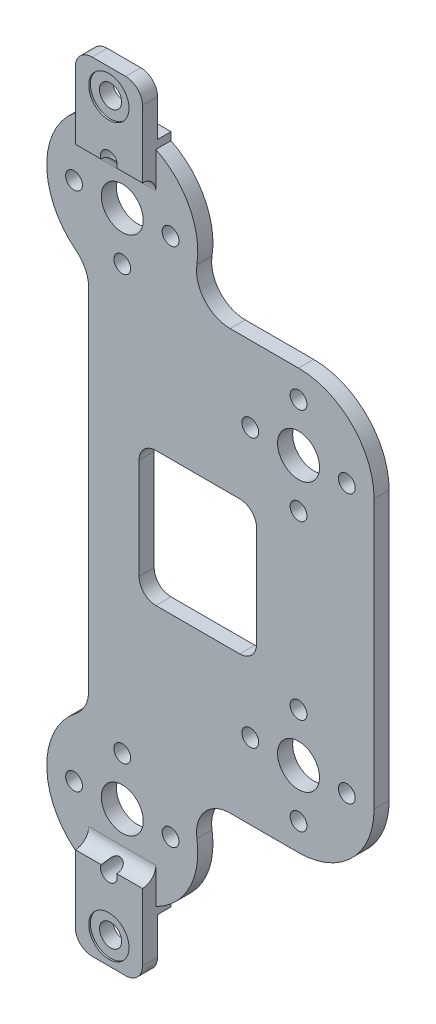
from build123d import *
from OCP.BRepFilletAPI import BRepFilletAPI_MakeFillet

# Parameters (mm, degrees)
SKETCH_1_W                   = 20
SKETCH_1_H                   = 232
EXTRUDE_1_DEPTH              = 4.5
FILLET_4_R                   = 5
EXTRUDE_START                = 4
EXTRUDE_4_DEPTH              = 4
SKETCH_9_W                   = 319.021375536
SKETCH_9_H                   = 251.112704656
SKETCH_9_W_2                 = 165.944204682
SKETCH_9_H_2                 = 200
CUT_EXTRUDE_1_DEPTH          = 4
FILLET_5_R                   = 4
HOLE_WIZARD_M6_2_D           = 6.6
HOLE_WIZARD_M6_2_CBORE_D     = 12
HOLE_WIZARD_M6_2_CBORE_DEPTH = 0.5
SKETCH_12_W                  = 65
SKETCH_12_H                  = 125
SKETCH_12_R                  = 6.25
EXTRUDE_5_DEPTH              = 4.5
SKETCH_14_R                  = 22.5
EXTRUDE_6_DEPTH              = 4.5
FILLET_6_R1                  = 10
FILLET_6_R2                  = 22.5
SKETCH_13_R                  = 6.25
CUT_EXTRUDE_2_DEPTH          = 139.39526726
HOLE_WIZARD_M6_1_D           = 5
SKETCH_17_W                  = 35
SKETCH_17_H                  = 40
CUT_EXTRUDE_3_DEPTH          = 139.395267266
FILLET_8_R                   = 5


with BuildPart() as part:
    # 草图1 → 凸台-拉伸1 (new body)
    with BuildSketch(Plane.XY):
        Rectangle(SKETCH_1_W, SKETCH_1_H)
    extrude(amount=EXTRUDE_1_DEPTH)

    # 圆角4
    fillet_4_edges = [part.edges().sort_by_distance(p)[0] for p in [
        (10, -116, 2.25),
        (-10, -116, 2.25),
        (-10, 116, 2.25),
        (10, 116, 2.25),
    ]]
    fillet(fillet_4_edges, radius=FILLET_4_R)

    # 草图8 → 凸台-拉伸4 (add)
    with BuildSketch(Plane.XY.offset(4.5).offset(EXTRUDE_START)):
        with BuildLine():
            Line((10, -91), (-10, -91))
            Line((-10, -91), (-10, -111))
            ThreePointArc((-10, -111), (-8.535533906, -114.535533906), (-5, -116))
            Line((-5, -116), (5, -116))
            ThreePointArc((5, -116), (8.535533906, -114.535533906), (10, -111))
            Line((10, -111), (10, -91))
        make_face()
        with BuildLine():
            Line((-10, 111), (-10, 91))
            Line((-10, 91), (10, 91))
            Line((10, 91), (10, 111))
            ThreePointArc((10, 111), (8.535533906, 114.535533906), (5, 116))
            Line((5, 116), (-5, 116))
            ThreePointArc((-5, 116), (-8.535533906, 114.535533906), (-10, 111))
        make_face()
    extrude(amount=-EXTRUDE_4_DEPTH)

    # 草图9 → 切除-拉伸1 (cut)
    with BuildSketch(Plane(origin=(0, 0, 0), x_dir=(-1, 0, 0), z_dir=(0, 0, -1))):
        Rectangle(SKETCH_9_W, SKETCH_9_H)
        Rectangle(SKETCH_9_W_2, SKETCH_9_H_2, mode=Mode.SUBTRACT)
    extrude(amount=-CUT_EXTRUDE_1_DEPTH, mode=Mode.SUBTRACT)

    # 圆角5
    fillet_5_edges = [part.edges().sort_by_distance(p)[0] for p in [
        (0, -91, 4.5),
        (0, 91, 4.5),
    ]]
    fillet(fillet_5_edges, radius=FILLET_5_R - 0.0001)  # a hair under: the kernel refuses the full size

    # M6 六角头螺栓的柱形沉头孔2 (through all)
    with Locations(Plane.XY.offset(8.5)):
        with Locations((0, 108.25), (0, -108.25)):
            CounterBoreHole(HOLE_WIZARD_M6_2_D / 2, HOLE_WIZARD_M6_2_CBORE_D / 2, HOLE_WIZARD_M6_2_CBORE_DEPTH)

    # 草图12 → 凸台-拉伸5 (add)
    with BuildSketch(Plane(origin=(0, 0, 0), x_dir=(-1, 0, 0), z_dir=(0, 0, -1))):
        with Locations((-42.5, 0)):
            Rectangle(SKETCH_12_W, SKETCH_12_H)
        with Locations((-52.5, 40)):
            Circle(SKETCH_12_R, mode=Mode.SUBTRACT)
        with Locations((-52.5, -40)):
            Circle(SKETCH_12_R, mode=Mode.SUBTRACT)
    extrude(amount=-EXTRUDE_5_DEPTH)

    # 草图14 → 凸台-拉伸6 (add)
    with BuildSketch(Plane(origin=(0, 0, 0), x_dir=(-1, 0, 0), z_dir=(0, 0, -1))):
        with Locations((0, 77.5)):
            Circle(SKETCH_14_R)
        with Locations((0, -77.5)):
            Circle(SKETCH_14_R)
    extrude(amount=-EXTRUDE_6_DEPTH)

    # 圆角6: one fillet with a radius per group of edges: ONE call of the kernel's fillet builder (fillet() takes one radius for all edges)
    fillet_6_edges_1 = [part.edges().sort_by_distance(p)[0] for p in [
        (16.770509831, 62.5, 2.25),
        (-10, 57.344355629, 2.25),
        (16.770509831, -62.5, 2.25),
        (-10, -57.344355629, 2.25),
    ]]
    fillet_6_edges_2 = [part.edges().sort_by_distance(p)[0] for p in [
        (75, 62.5, 2.25),
        (75, -62.5, 2.25),
    ]]
    fillet_6 = BRepFilletAPI_MakeFillet(part.part.solid().wrapped)
    for e in fillet_6_edges_1:
        fillet_6.Add(FILLET_6_R1, e.wrapped)
    for e in fillet_6_edges_2:
        fillet_6.Add(FILLET_6_R2, e.wrapped)
    add(Compound.cast(fillet_6.Shape()), mode=Mode.REPLACE)

    # 草图13 → 切除-拉伸2 (cut, through all)
    with BuildSketch(Plane(origin=(0, 0, 0), x_dir=(-1, 0, 0), z_dir=(0, 0, -1))):
        with Locations((0, 77.5)):
            Circle(SKETCH_13_R)
        with Locations((0, -77.5)):
            Circle(SKETCH_13_R)
    extrude(amount=-CUT_EXTRUDE_2_DEPTH, mode=Mode.SUBTRACT)

    # M6 螺纹孔1 (through all)
    with Locations(Plane(origin=(0, 0, 0), x_dir=(-1, 0, 0), z_dir=(0, 0, -1))):
        with Locations((-66.875, 40), (-52.5, 54.375), (-38.125, 40), (-52.5, 25.625), (-52.5, -25.625), (-38.125, -40), (-66.875, -40), (-52.5, -54.375), (0, -63.125), (14.375, -77.5), (-14.375, -77.5), (0, -91.875), (0, 91.875), (14.375, 77.5), (-14.375, 77.5), (0, 63.125)):
            Hole(HOLE_WIZARD_M6_1_D / 2)

    # 草图17 → 切除-拉伸3 (cut, through all)
    with BuildSketch(Plane(origin=(0, 0, 0), x_dir=(-1, 0, 0), z_dir=(0, 0, -1))):
        with Locations((-22.5, 0)):
            Rectangle(SKETCH_17_W, SKETCH_17_H)
    extrude(amount=-CUT_EXTRUDE_3_DEPTH, mode=Mode.SUBTRACT)

    # 圆角8
    fillet_8_edges = [part.edges().sort_by_distance(p)[0] for p in [
        (40, -20, 2.25),
        (40, 20, 2.25),
        (5, 20, 2.25),
        (5, -20, 2.25),
    ]]
    fillet(fillet_8_edges, radius=FILLET_8_R)


solid = part.part
